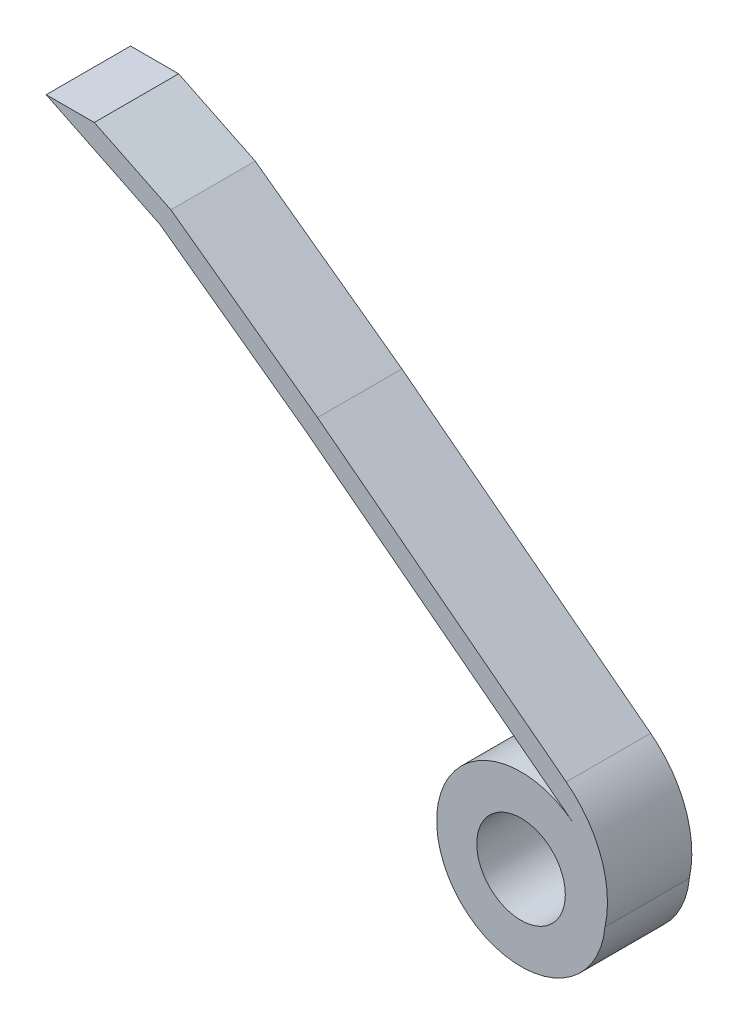
from build123d import *

# Parameters (mm, degrees)
CROQUIS1_R              = 4
CROQUIS1_R_2            = 2.1
SALIENTE_EXTRUIR1_DEPTH = 4
SALIENTE_EXTRUIR3_START = -4
SALIENTE_EXTRUIR3_DEPTH = 4
REDONDEO4_R             = 5


# Read off the part's stored shape, not the designer's step: Saliente-Extruir3
with BuildPart() as part:
    # Croquis1 → Saliente-Extruir1 (new body)
    with BuildSketch(Plane.XY):
        Circle(CROQUIS1_R)
        Circle(CROQUIS1_R_2, mode=Mode.SUBTRACT)
    extrude(amount=SALIENTE_EXTRUIR1_DEPTH)

    # Saliente-Extruir3 outline → Saliente-Extruir3 (add)
    with BuildSketch(Plane.XY.offset(4).offset(SALIENTE_EXTRUIR3_START)):
        with BuildLine():
            Line((3.981796419, -0.381178801), (6.969960414, 0.948790732))
            Line((6.969960414, 0.948790732), (-9.647602311, 13.722473625))
            Line((-9.647602311, 13.722473625), (-16.604293056, 18.776920888))
            Line((-16.604293056, 18.776920888), (-20.232922351, 20.546770492))
            Line((-20.232922351, 20.546770492), (-22.514043525, 20.546770492))
            Line((-22.514043525, 20.546770492), (-17.121307849, 17.916484969))
            Line((-17.121307849, 17.916484969), (-10.246328253, 12.921405689))
            Line((-10.246328253, 12.921405689), (2.437756913, 3.171331146))
            ThreePointArc((2.437756913, 3.171331146), (3.668480336, 1.594444112), (3.981796419, -0.381178801))
        make_face()
    extrude(amount=SALIENTE_EXTRUIR3_DEPTH)

    # Redondeo4
    # the kernel refuses this fillet: 5 mm, written as the material it takes off along each edge
    with BuildSketch(Plane(origin=(6.969960414, 0.948790732, -15.212006729), x_dir=(-0.9135962080773964, -0.4066226365890155, 0), z_dir=(0, 0, 1))) as redondeo4_piece_1:
        with BuildLine():
            CenterArc((7.295339023, -2.966960117), REDONDEO4_R, 143.601912221, 64.856271299)
            Line((2.899513394, -5.349546324), (2.811596881, -5.397198048))
            Line((2.811596881, -5.397198048), (-0.087916513, -0.047651724))
            Line((-0.087916513, -0.047651724), (0, 0.1))
            ThreePointArc((0, 0.1), (1.635385507, 0.1), (3.190279653, 0.059339202))
            Line((3.190279653, 0.059339202), (3.270771013, 0))
        make_face()
    extrude(amount=34.424013457, mode=Mode.SUBTRACT)


solid = part.part
